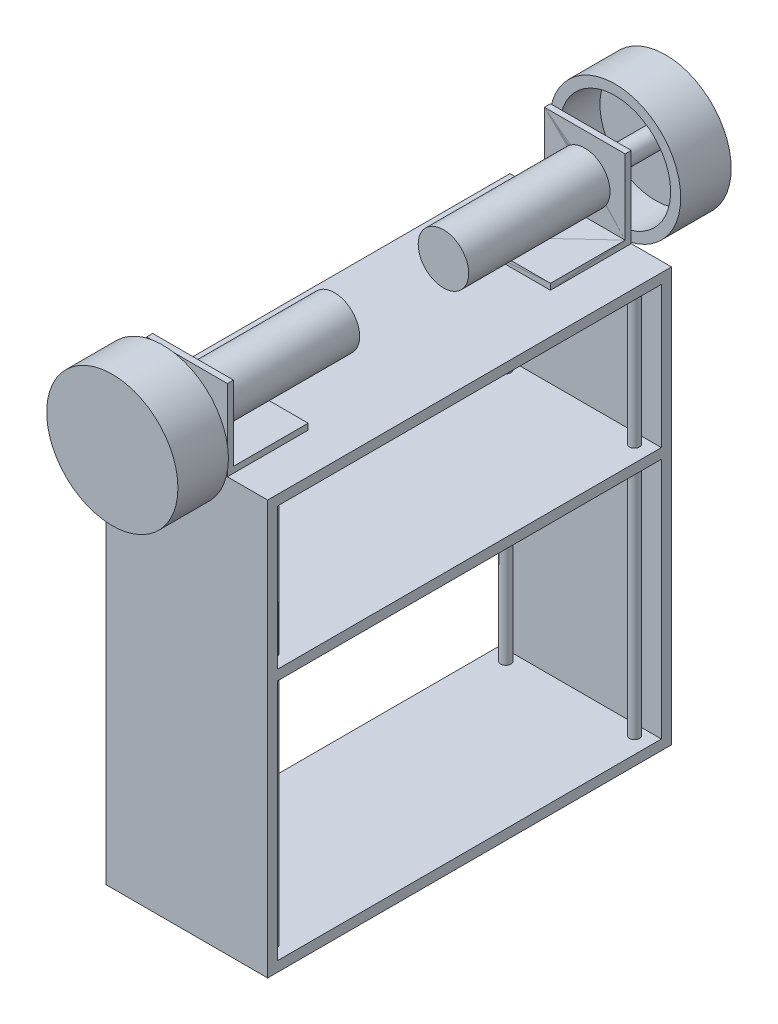
from build123d import *

# Parameters (mm, degrees)
SKETCH1_W            = 80
SKETCH1_H            = 100
BOSS_EXTRUDE1_DEPTH  = 5
SKETCH2_W            = 40
SKETCH2_H            = 40
BOSS_EXTRUDE2_DEPTH  = 40
SHELL2_START         = -25.963680664
SHELL2_OUTLINE_W     = 40
SHELL2_OUTLINE_H     = 37
SHELL2_DEPTH         = 37
SKETCH4_R            = 5
CUT_EXTRUDE2_DEPTH   = 3
SPLIT1_START         = 5
SPLIT1_OUTLINE_W     = 40
SPLIT1_OUTLINE_H     = 40
SPLIT1_DEPTH         = 40
SPLIT1_START_2       = -28.963680664
SPLIT1_2_OUTLINE_W   = 40
SPLIT1_2_OUTLINE_H   = 3
SPLIT1_2_DEPTH       = 40
SPLIT1_3_OUTLINE_W   = 40
SPLIT1_3_OUTLINE_H   = 37
SPLIT1_3_OUTLINE_R   = 5
SPLIT1_3_DEPTH       = 3
SPLIT1_START_3       = 131.036319336
SPLIT1_4_OUTLINE_W   = 40
SPLIT1_4_OUTLINE_H   = 3
SPLIT1_4_DEPTH       = 40
SPLIT1_START_4       = 168.036319336
SPLIT1_5_OUTLINE_W   = 40
SPLIT1_5_OUTLINE_H   = 37
SPLIT1_5_OUTLINE_R   = 5
SPLIT1_5_DEPTH       = 3
SKETCH7_R            = 12.5
BOSS_EXTRUDE3_DEPTH  = 70
SKETCH8_R            = 5
BOSS_EXTRUDE4_DEPTH  = 25
SKETCH9_R            = 32.5
BOSS_EXTRUDE9_DEPTH  = 10
SKETCH13_R           = 32.5
BOSS_EXTRUDE10_DEPTH = 15
SKETCH14_R           = 27.5
SKETCH14_R_2         = 5
CUT_EXTRUDE4_DEPTH   = 20
SPLIT2_START         = -65.963680664
SPLIT2_OUTLINE_R     = 32.5
SPLIT2_OUTLINE_R_2   = 27.5
SPLIT2_OUTLINE_R_3   = 5
SPLIT2_DEPTH         = 25
SPLIT2_2_OUTLINE_R   = 27.5
SPLIT2_2_OUTLINE_R_2 = 5
SPLIT2_2_DEPTH       = 5
SPLIT2_3_OUTLINE_R   = 32.5
SPLIT2_3_DEPTH       = 25
SPLIT2_START_2       = 183.036319336
SPLIT2_4_OUTLINE_R   = 32.5
SPLIT2_4_OUTLINE_R_2 = 27.5
SPLIT2_4_OUTLINE_R_3 = 5
SPLIT2_4_DEPTH       = 25
SPLIT2_START_3       = 203.036319336
SPLIT2_5_OUTLINE_R   = 27.5
SPLIT2_5_OUTLINE_R_2 = 5
SPLIT2_5_DEPTH       = 5
SPLIT2_6_OUTLINE_R   = 32.5
SPLIT2_6_DEPTH       = 25
SKETCH18_R           = 2.502634572
BOSS_EXTRUDE11_DEPTH = 200
EXTRUDE_THIN2_DEPTH  = 80
BOSS_EXTRUDE21_START = 120
SKETCH45_W           = 80
SKETCH45_H           = 190
BOSS_EXTRUDE21_DEPTH = 5


# Read off the part's stored shape, not the designer's step: Shell2, Split1, Split2
with BuildPart() as part:
    # Sketch1 → Boss-Extrude1 (new body)
    with BuildSketch(Plane(origin=(0, 0, 0), x_dir=(1, 0, 0), z_dir=(0, 1, 0))):
        with Locations((-34.993542676, -21.036319336)):
            Rectangle(SKETCH1_W, SKETCH1_H)
    extrude(amount=BOSS_EXTRUDE1_DEPTH)

    # Sketch2 → Boss-Extrude2 (add)
    with BuildSketch(Plane(origin=(0, 5, 0), x_dir=(1, 0, 0), z_dir=(0, 1, 0))):
        with Locations((-34.926329237, 8.963680664)):
            Rectangle(SKETCH2_W, SKETCH2_H)
    extrude(amount=BOSS_EXTRUDE2_DEPTH)

    # Shell2 outline → Shell2 (cut)
    with BuildSketch(Plane.XY.offset(SHELL2_START)):
        with Locations((-34.926329237, 26.5)):
            Rectangle(SHELL2_OUTLINE_W, SHELL2_OUTLINE_H)
    extrude(amount=SHELL2_DEPTH, mode=Mode.SUBTRACT)

    # Sketch4 → Cut-Extrude2 (cut)
    with BuildSketch(Plane(origin=(0, 0, -28.963680664), x_dir=(-1, 0, 0), z_dir=(0, 0, -1))):
        with Locations((34.926329237, 25)):
            Circle(SKETCH4_R)
    extrude(amount=-CUT_EXTRUDE2_DEPTH, mode=Mode.SUBTRACT)

    # Mirror1: part across plane


with BuildPart() as part_1:
    add(part.part)
    add(part.part.mirror(Plane.XY.offset(71.036319336)))

    # Split1 outline → Split1 (cut)
    with BuildSketch(Plane(origin=(0, 0, 0), x_dir=(1, 0, 0), z_dir=(0, 1, 0)).offset(SPLIT1_START)):
        with Locations((-34.926329237, 8.963680664)):
            Rectangle(SPLIT1_OUTLINE_W, SPLIT1_OUTLINE_H)
        with Locations((-34.926329237, -151.036319336)):
            Rectangle(SPLIT1_OUTLINE_W, SPLIT1_OUTLINE_H)
    extrude(amount=SPLIT1_DEPTH, mode=Mode.SUBTRACT)

    # Sketch18 → Boss-Extrude11 (add)
    with BuildSketch(Plane(origin=(0, 0, 0), x_dir=(-1, 0, 0), z_dir=(0, -1, 0))):
        with Locations(Location((3.114578294, -160.885024814, 0), (0, 0, 270))):
            Circle(SKETCH18_R)
        with Locations(Location((3.114578294, 18.812386141, 0), (0, 0, 270))):
            Circle(SKETCH18_R)
        with Locations(Location((66.872507057, 18.812386141, 0), (0, 0, 270))):
            Circle(SKETCH18_R)
        with Locations(Location((66.872507057, -160.885024814, 0), (0, 0, 270))):
            Circle(SKETCH18_R)
    extrude(amount=BOSS_EXTRUDE11_DEPTH)

    # Sketch20 → Extrude-Thin2 (add, through all)
    with BuildSketch(Plane.ZY.offset(74.993542676)):
        Polygon((171.036319336, 0), (171.036319336, -200), (-28.963680664, -200), (-28.963680664, 0), (-23.963680664, 0), (-23.963680664, -195), (166.036319336, -195), (166.036319336, 0), align=None)
    extrude(amount=-EXTRUDE_THIN2_DEPTH)

    # Sketch45 → Boss-Extrude21 (add)
    with BuildSketch(Plane(origin=(0, -195, 0), x_dir=(1, 0, 0), z_dir=(0, 1, 0)).offset(BOSS_EXTRUDE21_START)):
        with Locations((-34.993542676, -71.036319336)):
            Rectangle(SKETCH45_W, SKETCH45_H)
    extrude(amount=BOSS_EXTRUDE21_DEPTH)


with BuildPart() as body_2:
    # Split1 2 outline → Split1 2 (new body)
    with BuildSketch(Plane.XY.offset(SPLIT1_START_2)):
        with Locations((-34.926329237, 6.5)):
            Rectangle(SPLIT1_2_OUTLINE_W, SPLIT1_2_OUTLINE_H)
    extrude(amount=SPLIT1_2_DEPTH)

    # Split1 3 outline → Split1 3 (add)
    with BuildSketch(Plane.XY.offset(SPLIT1_START_2)):
        with Locations((-34.926329237, 26.5)):
            Rectangle(SPLIT1_3_OUTLINE_W, SPLIT1_3_OUTLINE_H)
        with Locations((-34.926329237, 25)):
            Circle(SPLIT1_3_OUTLINE_R, mode=Mode.SUBTRACT)
    extrude(amount=SPLIT1_3_DEPTH)


with BuildPart() as body_3:
    # Split1 4 outline → Split1 4 (new body)
    with BuildSketch(Plane.XY.offset(SPLIT1_START_3)):
        with Locations((-34.926329237, 6.5)):
            Rectangle(SPLIT1_4_OUTLINE_W, SPLIT1_4_OUTLINE_H)
    extrude(amount=SPLIT1_4_DEPTH)

    # Split1 5 outline → Split1 5 (add)
    with BuildSketch(Plane.XY.offset(SPLIT1_START_4)):
        with Locations((-34.926329237, 26.5)):
            Rectangle(SPLIT1_5_OUTLINE_W, SPLIT1_5_OUTLINE_H)
        with Locations((-34.926329237, 25)):
            Circle(SPLIT1_5_OUTLINE_R, mode=Mode.SUBTRACT)
    extrude(amount=SPLIT1_5_DEPTH)

    # Sketch7 → Boss-Extrude3 (add)
    with BuildSketch(Plane(origin=(0, 0, 168.036319336), x_dir=(-1, 0, 0), z_dir=(0, 0, -1))):
        with Locations((34.926329237, 25)):
            Circle(SKETCH7_R)
    extrude(amount=BOSS_EXTRUDE3_DEPTH)

    # Sketch8 → Boss-Extrude4 (add)
    with BuildSketch(Plane.XY.offset(168.036319336)):
        with Locations(Location((-34.926329237, 25, 0), (0, 0, 180))):
            Circle(SKETCH8_R)
    extrude(amount=BOSS_EXTRUDE4_DEPTH)

    # Sketch9 → Boss-Extrude9 (add)
    with BuildSketch(Plane.XY.offset(193.036319336)):
        with Locations((-34.926329237, 25)):
            Circle(SKETCH9_R)
    extrude(amount=-BOSS_EXTRUDE9_DEPTH)

    # Sketch13 → Boss-Extrude10 (add)
    with BuildSketch(Plane.XY.offset(193.036319336)):
        with Locations((-34.926329237, 25)):
            Circle(SKETCH13_R)
    extrude(amount=BOSS_EXTRUDE10_DEPTH)

    # Sketch14 → Cut-Extrude4 (cut)
    with BuildSketch(Plane(origin=(0, 0, 183.036319336), x_dir=(-1, 0, 0), z_dir=(0, 0, -1))):
        with Locations((34.926329237, 25)):
            Circle(SKETCH14_R)
        with Locations((34.926329237, 25)):
            Circle(SKETCH14_R_2, mode=Mode.SUBTRACT)
    extrude(amount=-CUT_EXTRUDE4_DEPTH, mode=Mode.SUBTRACT)


with BuildPart() as body_4:
    # Mirror2: mirrored copy
    add(body_3.part.mirror(Plane.XY.offset(71.036319336)))

    # Split2 3 outline → Split2 3 (cut)
    with BuildSketch(Plane.XY.offset(SPLIT2_START)):
        with Locations((-34.926329237, 25)):
            Circle(SPLIT2_3_OUTLINE_R)
    extrude(amount=SPLIT2_3_DEPTH, mode=Mode.SUBTRACT)


with BuildPart() as body_5:
    # Split2 outline → Split2 (new body)
    # profile 1 of 2: a face of its own
    with BuildSketch(Plane.XY.offset(SPLIT2_START)):
        with Locations((-34.926329237, 25)):
            Circle(SPLIT2_OUTLINE_R)
        with Locations((-34.926329237, 25)):
            Circle(SPLIT2_OUTLINE_R_2, mode=Mode.SUBTRACT)
    # profile 2 of 2: a face of its own
    with BuildSketch(Plane.XY.offset(SPLIT2_START)):
        with Locations((-34.926329237, 25)):
            Circle(SPLIT2_OUTLINE_R_3)
    extrude(amount=SPLIT2_DEPTH)

    # Split2 2 outline → Split2 2 (add)
    with BuildSketch(Plane.XY.offset(SPLIT2_START)):
        with Locations((-34.926329237, 25)):
            Circle(SPLIT2_2_OUTLINE_R)
        with Locations((-34.926329237, 25)):
            Circle(SPLIT2_2_OUTLINE_R_2, mode=Mode.SUBTRACT)
    extrude(amount=SPLIT2_2_DEPTH)


with BuildPart() as body_6:
    # Split2 4 outline → Split2 4 (new body)
    # profile 1 of 2: a face of its own
    with BuildSketch(Plane.XY.offset(SPLIT2_START_2)):
        with Locations((-34.926329237, 25)):
            Circle(SPLIT2_4_OUTLINE_R)
        with Locations((-34.926329237, 25)):
            Circle(SPLIT2_4_OUTLINE_R_2, mode=Mode.SUBTRACT)
    # profile 2 of 2: a face of its own
    with BuildSketch(Plane.XY.offset(SPLIT2_START_2)):
        with Locations((-34.926329237, 25)):
            Circle(SPLIT2_4_OUTLINE_R_3)
    extrude(amount=SPLIT2_4_DEPTH)

    # Split2 5 outline → Split2 5 (add)
    with BuildSketch(Plane.XY.offset(SPLIT2_START_3)):
        with Locations((-34.926329237, 25)):
            Circle(SPLIT2_5_OUTLINE_R)
        with Locations((-34.926329237, 25)):
            Circle(SPLIT2_5_OUTLINE_R_2, mode=Mode.SUBTRACT)
    extrude(amount=SPLIT2_5_DEPTH)


with BuildPart() as body_3_1:
    add(body_3.part)

    # Split2 6 outline → Split2 6 (cut)
    with BuildSketch(Plane.XY.offset(SPLIT2_START_2)):
        with Locations((-34.926329237, 25)):
            Circle(SPLIT2_6_OUTLINE_R)
    extrude(amount=SPLIT2_6_DEPTH, mode=Mode.SUBTRACT)


solid = Compound([part_1.part, body_2.part, body_4.part, body_5.part, body_6.part, body_3_1.part])
